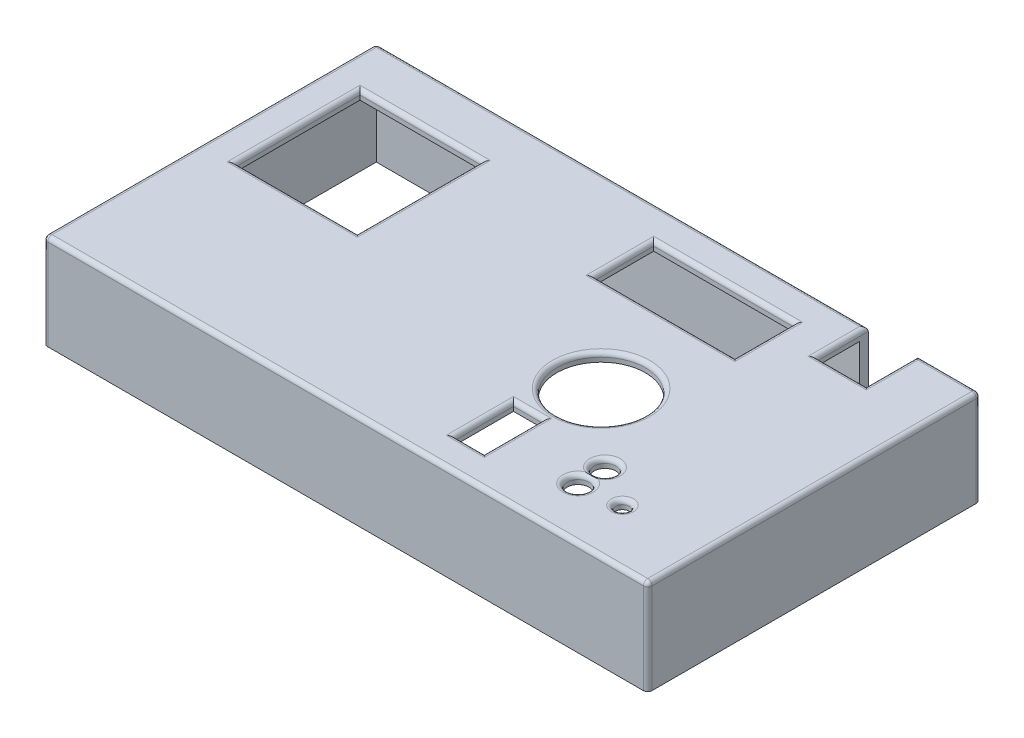
from build123d import *

# Parameters (mm, degrees)
BOSS_EXTRUDE3_DEPTH = 20
SKETCH5_W           = 6.84038608
SKETCH5_H           = 13.609372619
SKETCH5_R           = 2.512024295
SKETCH5_R_2         = 1.584207127
SKETCH5_R_3         = 10.279019558
SKETCH5_W_2         = 28.198374396
SKETCH5_H_2         = 28.800355601
SKETCH5_W_3         = 32.523037846
SKETCH5_H_3         = 13.726974854
BOSS_EXTRUDE4_DEPTH = 2
FILLET3_R           = 1


with BuildPart() as part:
    # Sketch2 → Boss-Extrude3 (new body)
    with BuildSketch(Plane(origin=(0, 0, 0), x_dir=(1, 0, 0), z_dir=(0, 1, 0))):
        Polygon((110.99009398, 73.936525273), (-2.957073914, 73.936525273), (-2.957073914, -3.151612903), (136.997180594, -3.151612903), (136.997180594, 73.936525273), (122.49022098, 73.936525273), (122.49022098, 71.936525273), (134.997180594, 71.936525273), (134.997180594, -1.151612903), (-0.957073914, -1.151612903), (-0.957073914, 71.936525273), (110.99009398, 71.936525273), align=None)
    extrude(amount=BOSS_EXTRUDE3_DEPTH)

    # Sketch5 → Boss-Extrude4 (add)
    # profile 1 of 2: a face of its own
    with BuildSketch(Plane(origin=(0, 20, 0), x_dir=(1, 0, 0), z_dir=(0, 1, 0))):
        Polygon((110.99009398, 61.978765558), (110.99009398, 71.936525273), (-0.957073914, 71.936525273), (-0.957073914, -1.151612903), (134.997180594, -1.151612903), (134.997180594, 71.936525273), (122.49022098, 71.936525273), (122.49022098, 61.978765558), align=None)
        with Locations((88.364033528, 11.013703328)):
            Rectangle(SKETCH5_W, SKETCH5_H, mode=Mode.SUBTRACT)
        with Locations(Location((108.873726401, 8.847726695, 0), (0, 0, 270))):
            Circle(SKETCH5_R, mode=Mode.SUBTRACT)
        with Locations(Location((118.390524318, 9.61196952, 0), (0, 0, 270))):
            Circle(SKETCH5_R_2, mode=Mode.SUBTRACT)
        with Locations(Location((108.746726147, 15.197739395, 0), (0, 0, 270))):
            Circle(SKETCH5_R, mode=Mode.SUBTRACT)
        with Locations(Location((92.483108966, 30.567056134, 0), (0, 0, 270))):
            Circle(SKETCH5_R_3, mode=Mode.SUBTRACT)
        with Locations((18.822961646, 48.078587758)):
            Rectangle(SKETCH5_W_2, SKETCH5_H_2, mode=Mode.SUBTRACT)
        with Locations((85.307569215, 59.332727965)):
            Rectangle(SKETCH5_W_3, SKETCH5_H_3, mode=Mode.SUBTRACT)
    # profile 2 of 2: a face of its own
    with BuildSketch(Plane(origin=(0, 20, 0), x_dir=(1, 0, 0), z_dir=(0, 1, 0))):
        Polygon((136.997180594, 73.936525273), (122.49022098, 73.936525273), (122.49022098, 71.936525273), (134.997180594, 71.936525273), (134.997180594, -1.151612903), (-0.957073914, -1.151612903), (-0.957073914, 71.936525273), (110.99009398, 71.936525273), (110.99009398, 73.936525273), (-2.957073914, 73.936525273), (-2.957073914, -3.151612903), (136.997180594, -3.151612903), align=None)
    extrude(amount=BOSS_EXTRUDE4_DEPTH)

    # Fillet3
    # the kernel refuses this fillet: 1 mm, written as the material it takes off along each edge
    with BuildSketch(Plane(origin=(135.997180594, 21, -72.936525273), x_dir=(1, 0, 0), z_dir=(0, 0, -1))) as fillet3_piece_1_section:
        Polygon((0, 0), (FILLET3_R, 0), (FILLET3_R, -FILLET3_R), (0, -FILLET3_R), align=None)
    fillet3_piece_1 = extrude(amount=FILLET3_R, mode=Mode.PRIVATE)
    fillet3_piece_1 = fillet3_piece_1 - Plane(origin=(135.997180594, 21, -72.936525273), x_dir=(-0.7071067811865475, -0.7071067811865475, 0), z_dir=(0, 0, -1)) * Sphere(FILLET3_R, mode=Mode.PRIVATE)
    add(fillet3_piece_1, mode=Mode.SUBTRACT)
    with BuildSketch(Plane(origin=(135.997180594, 21, 2.151612903), x_dir=(0, 0, 1), z_dir=(1, 0, 0))) as fillet3_piece_2_section:
        Polygon((0, 0), (FILLET3_R, 0), (FILLET3_R, -FILLET3_R), (0, -FILLET3_R), align=None)
    fillet3_piece_2 = extrude(amount=FILLET3_R, mode=Mode.PRIVATE)
    fillet3_piece_2 = fillet3_piece_2 - Plane(origin=(135.997180594, 21, 2.151612903), x_dir=(0, -0.7071067811865475, -0.7071067811865475), z_dir=(1, 0, 0)) * Sphere(FILLET3_R, mode=Mode.PRIVATE)
    add(fillet3_piece_2, mode=Mode.SUBTRACT)
    with BuildSketch(Plane(origin=(-1.957073914, 21, 2.151612903), x_dir=(-1, 0, 0), z_dir=(0, 0, 1))) as fillet3_piece_3_section:
        Polygon((0, 0), (FILLET3_R, 0), (FILLET3_R, -FILLET3_R), (0, -FILLET3_R), align=None)
    fillet3_piece_3 = extrude(amount=FILLET3_R, mode=Mode.PRIVATE)
    fillet3_piece_3 = fillet3_piece_3 - Plane(origin=(-1.957073914, 21, 2.151612903), x_dir=(0.7071067811865475, -0.7071067811865475, 0), z_dir=(0, 0, 1)) * Sphere(FILLET3_R, mode=Mode.PRIVATE)
    add(fillet3_piece_3, mode=Mode.SUBTRACT)
    with BuildSketch(Plane(origin=(-1.957073914, 21, -72.936525273), x_dir=(-1, 0, 0), z_dir=(0, 0, -1))) as fillet3_piece_4_section:
        Polygon((0, 0), (FILLET3_R, 0), (FILLET3_R, FILLET3_R), (0, FILLET3_R), align=None)
    fillet3_piece_4 = extrude(amount=FILLET3_R, mode=Mode.PRIVATE)
    fillet3_piece_4 = fillet3_piece_4 - Plane(origin=(-1.957073914, 21, -72.936525273), x_dir=(0.7071067811865475, -0.7071067811865475, 0), z_dir=(0, 0, -1)) * Sphere(FILLET3_R, mode=Mode.PRIVATE)
    add(fillet3_piece_4, mode=Mode.SUBTRACT)
    with BuildSketch(Plane(origin=(136.997180594, -2.5, -73.936525273), x_dir=(-1, 0, 0), z_dir=(0, 1, 0)), Plane(origin=(136.997180594, -2.5, 3.151612903), x_dir=(0, 0, -1), z_dir=(0, 1, 0)), Plane(origin=(-2.957073914, -2.5, 3.151612903), x_dir=(1, 0, 0), z_dir=(0, 1, 0))) as fillet3_piece_5:
        with BuildLine():
            CenterArc((FILLET3_R, FILLET3_R), FILLET3_R, 180, 90)
            Line((0, FILLET3_R), (0, 0))
            Line((0, 0), (FILLET3_R, 0))
        make_face()
    extrude(amount=23.5, mode=Mode.SUBTRACT)
    with BuildSketch(Plane(origin=(-2.957073914, -2.5, -73.936525273), x_dir=(1, 0, 0), z_dir=(0, 1, 0))) as fillet3_piece_6:
        with BuildLine():
            CenterArc((FILLET3_R, -FILLET3_R), FILLET3_R, 90, 90)
            Line((0, -FILLET3_R), (0, 0))
            Line((0, 0), (FILLET3_R, 0))
        make_face()
    extrude(amount=23.5, mode=Mode.SUBTRACT)
    with BuildSketch(Plane(origin=(69.046050292, 22, -52.469240538), x_dir=(0, -1, 0), z_dir=(0, 0, -1)), Plane(origin=(101.569088138, 22, -66.196215392), x_dir=(0, -1, 0), z_dir=(0, 0, 1))) as fillet3_piece_7:
        with BuildLine():
            CenterArc((FILLET3_R, FILLET3_R), FILLET3_R, 180, 90)
            Line((0, FILLET3_R), (0, 0))
            Line((0, 0), (FILLET3_R, 0))
        make_face()
    extrude(amount=13.726974854, mode=Mode.SUBTRACT)
    with BuildSketch(Plane(origin=(4.723774448, 22, -33.678409957), x_dir=(0, -1, 0), z_dir=(0, 0, -1)), Plane(origin=(32.922148844, 22, -62.478765558), x_dir=(0, -1, 0), z_dir=(0, 0, 1))) as fillet3_piece_8:
        with BuildLine():
            CenterArc((FILLET3_R, FILLET3_R), FILLET3_R, 180, 90)
            Line((0, FILLET3_R), (0, 0))
            Line((0, 0), (FILLET3_R, 0))
        make_face()
    extrude(amount=28.800355601, mode=Mode.SUBTRACT)
    with BuildSketch(Plane(origin=(84.943840488, 22, -4.209017018), x_dir=(0, -1, 0), z_dir=(0, 0, -1)), Plane(origin=(91.784226568, 22, -17.818389637), x_dir=(0, -1, 0), z_dir=(0, 0, 1))) as fillet3_piece_9:
        with BuildLine():
            CenterArc((FILLET3_R, FILLET3_R), FILLET3_R, 180, 90)
            Line((0, FILLET3_R), (0, 0))
            Line((0, 0), (FILLET3_R, 0))
        make_face()
    extrude(amount=13.609372619, mode=Mode.SUBTRACT)
    with BuildSketch(Plane(origin=(110.99009398, 22, -76.436525273), x_dir=(-1, 0, 0), z_dir=(0, 0, 1)), Plane(origin=(122.49022098, 22, -76.436525273), x_dir=(0, -1, 0), z_dir=(0, 0, 1))) as fillet3_piece_10:
        with BuildLine():
            CenterArc((FILLET3_R, FILLET3_R), FILLET3_R, 180, 90)
            Line((0, FILLET3_R), (0, 0))
            Line((0, 0), (FILLET3_R, 0))
        make_face()
    extrude(amount=14.457759716, mode=Mode.SUBTRACT)
    with BuildSketch(Plane(origin=(32.922148844, 22, -33.678409957), x_dir=(0, -1, 0), z_dir=(-1, 0, 0)), Plane(origin=(4.723774448, 22, -62.478765558), x_dir=(0, -1, 0), z_dir=(1, 0, 0))) as fillet3_piece_11:
        with BuildLine():
            CenterArc((FILLET3_R, FILLET3_R), FILLET3_R, 180, 90)
            Line((0, FILLET3_R), (0, 0))
            Line((0, 0), (FILLET3_R, 0))
        make_face()
    extrude(amount=28.198374397, mode=Mode.SUBTRACT)
    with BuildSketch(Plane(origin=(91.784226568, 22, -4.209017018), x_dir=(0, -1, 0), z_dir=(-1, 0, 0)), Plane(origin=(84.943840488, 22, -17.818389637), x_dir=(0, -1, 0), z_dir=(1, 0, 0))) as fillet3_piece_12:
        with BuildLine():
            CenterArc((FILLET3_R, FILLET3_R), FILLET3_R, 180, 90)
            Line((0, FILLET3_R), (0, 0))
            Line((0, 0), (FILLET3_R, 0))
        make_face()
    extrude(amount=6.840386081, mode=Mode.SUBTRACT)
    with BuildSketch(Plane(origin=(118.390524318, 22, -9.61196952), x_dir=(0, 0, 1), z_dir=(-1, 0, 0))) as fillet3_piece_13:
        with BuildLine():
            CenterArc((1.584207127 + FILLET3_R, -FILLET3_R), FILLET3_R, 90, 90)
            Line((1.584207127 + FILLET3_R, 0), (1.584207127, 0))
            Line((1.584207127, 0), (1.584207127, -FILLET3_R))
        make_face()
    revolve(axis=Axis((118.390524318, 22, -9.61196952), (0, 1, 0)), mode=Mode.SUBTRACT)
    with BuildSketch(Plane(origin=(92.483108966, 22, -30.567056134), x_dir=(0, 0, 1), z_dir=(-1, 0, 0))) as fillet3_piece_14:
        with BuildLine():
            CenterArc((10.279019558 + FILLET3_R, -FILLET3_R), FILLET3_R, 90, 90)
            Line((10.279019558 + FILLET3_R, 0), (10.279019558, 0))
            Line((10.279019558, 0), (10.279019558, -FILLET3_R))
        make_face()
    revolve(axis=Axis((92.483108966, 22, -30.567056134), (0, 1, 0)), mode=Mode.SUBTRACT)
    with BuildSketch(Plane(origin=(108.746726147, 22, -15.197739395), x_dir=(0, 0, 1), z_dir=(-1, 0, 0))) as fillet3_piece_15:
        with BuildLine():
            CenterArc((2.512024295 + FILLET3_R, -FILLET3_R), FILLET3_R, 90, 90)
            Line((2.512024295 + FILLET3_R, 0), (2.512024295, 0))
            Line((2.512024295, 0), (2.512024295, -FILLET3_R))
        make_face()
    revolve(axis=Axis((108.746726147, 22, -15.197739395), (0, 1, 0)), mode=Mode.SUBTRACT)
    with BuildSketch(Plane(origin=(108.873726401, 22, -8.847726695), x_dir=(0, 0, 1), z_dir=(-1, 0, 0))) as fillet3_piece_16:
        with BuildLine():
            CenterArc((2.512024295 + FILLET3_R, -FILLET3_R), FILLET3_R, 90, 90)
            Line((2.512024295 + FILLET3_R, 0), (2.512024295, 0))
            Line((2.512024295, 0), (2.512024295, -FILLET3_R))
        make_face()
    revolve(axis=Axis((108.873726401, 22, -8.847726695), (0, 1, 0)), mode=Mode.SUBTRACT)
    with BuildSketch(Plane(origin=(122.49022098, 22, -61.978765558), x_dir=(0, -1, 0), z_dir=(-1, 0, 0))) as fillet3_piece_17:
        with BuildLine():
            CenterArc((FILLET3_R, FILLET3_R), FILLET3_R, 180, 90)
            Line((0, FILLET3_R), (0, 0))
            Line((0, 0), (FILLET3_R, 0))
        make_face()
    extrude(amount=11.500127, mode=Mode.SUBTRACT)
    with BuildSketch(Plane(origin=(101.569088138, 22, -52.469240538), x_dir=(0, -1, 0), z_dir=(-1, 0, 0)), Plane(origin=(69.046050292, 22, -66.196215392), x_dir=(0, -1, 0), z_dir=(1, 0, 0))) as fillet3_piece_18:
        with BuildLine():
            CenterArc((FILLET3_R, FILLET3_R), FILLET3_R, 180, 90)
            Line((0, FILLET3_R), (0, 0))
            Line((0, 0), (FILLET3_R, 0))
        make_face()
    extrude(amount=32.523037846, mode=Mode.SUBTRACT)
    with BuildSketch(Plane(origin=(113.49009398, 22, -73.936525273), x_dir=(0, -1, 0), z_dir=(-1, 0, 0))) as fillet3_piece_19:
        with BuildLine():
            CenterArc((FILLET3_R, FILLET3_R), FILLET3_R, 180, 90)
            Line((0, FILLET3_R), (0, 0))
            Line((0, 0), (FILLET3_R, 0))
        make_face()
    extrude(amount=115.447167894, mode=Mode.SUBTRACT)
    with BuildSketch(Plane(origin=(-2.957073914, 22, -72.936525273), x_dir=(0, -1, 0), z_dir=(0, 0, 1)), Plane(origin=(136.997180594, 22, 2.151612903), x_dir=(0, -1, 0), z_dir=(0, 0, -1))) as fillet3_piece_20:
        with BuildLine():
            CenterArc((FILLET3_R, FILLET3_R), FILLET3_R, 180, 90)
            Line((0, FILLET3_R), (0, 0))
            Line((0, 0), (FILLET3_R, 0))
        make_face()
    extrude(amount=75.088138176, mode=Mode.SUBTRACT)
    with BuildSketch(Plane(origin=(-1.957073914, 22, 3.151612903), x_dir=(0, -1, 0), z_dir=(1, 0, 0))) as fillet3_piece_21:
        with BuildLine():
            CenterArc((FILLET3_R, FILLET3_R), FILLET3_R, 180, 90)
            Line((0, FILLET3_R), (0, 0))
            Line((0, 0), (FILLET3_R, 0))
        make_face()
    extrude(amount=137.954254509, mode=Mode.SUBTRACT)
    with BuildSketch(Plane(origin=(135.997180594, 22, -73.936525273), x_dir=(0, -1, 0), z_dir=(-1, 0, 0))) as fillet3_piece_22:
        with BuildLine():
            CenterArc((FILLET3_R, FILLET3_R), FILLET3_R, 180, 90)
            Line((0, FILLET3_R), (0, 0))
            Line((0, 0), (FILLET3_R, 0))
        make_face()
    extrude(amount=16.006959614, mode=Mode.SUBTRACT)
    with BuildSketch(Plane(origin=(101.569088138, 22, -52.469240538), x_dir=(0, -1, 0), z_dir=(-1, 0, 0))) as fillet3_piece_23a_section:
        with BuildLine():
            CenterArc((FILLET3_R, FILLET3_R), FILLET3_R, 180, 90)
            Line((0, FILLET3_R), (0, 0))
            Line((0, 0), (FILLET3_R, 0))
        make_face()
    fillet3_piece_23a = extrude(amount=35.023037846, mode=Mode.PRIVATE)
    fillet3_piece_23a = split(fillet3_piece_23a, bisect_by=Plane(origin=(69.046050292, 21.773604886, -52.242845424), z_dir=(-1, 0, 0)), keep=Keep.TOP, mode=Mode.PRIVATE)
    with BuildSketch(Plane(origin=(69.046050292, 22, -49.969240538), x_dir=(0, -1, 0), z_dir=(0, 0, -1))) as fillet3_piece_23b_section:
        with BuildLine():
            CenterArc((FILLET3_R, FILLET3_R), FILLET3_R, 180, 90)
            Line((0, FILLET3_R), (0, 0))
            Line((0, 0), (FILLET3_R, 0))
        make_face()
    fillet3_piece_23b = extrude(amount=16.226974854, mode=Mode.PRIVATE)
    fillet3_piece_23b = split(fillet3_piece_23b, bisect_by=Plane(origin=(68.819655178, 21.773604886, -52.469240538), z_dir=(0, 0, 1)), keep=Keep.TOP, mode=Mode.PRIVATE)
    fillet3_piece_23 = fillet3_piece_23a & fillet3_piece_23b
    add(fillet3_piece_23, mode=Mode.SUBTRACT)
    with BuildSketch(Plane(origin=(66.546050292, 22, -66.196215392), x_dir=(0, -1, 0), z_dir=(1, 0, 0))) as fillet3_piece_24a_section:
        with BuildLine():
            CenterArc((FILLET3_R, FILLET3_R), FILLET3_R, 180, 90)
            Line((0, FILLET3_R), (0, 0))
            Line((0, 0), (FILLET3_R, 0))
        make_face()
    fillet3_piece_24a = extrude(amount=35.023037846, mode=Mode.PRIVATE)
    fillet3_piece_24a = split(fillet3_piece_24a, bisect_by=Plane(origin=(69.046050292, 21.773604886, -66.422610507), z_dir=(-1, 0, 0)), keep=Keep.TOP, mode=Mode.PRIVATE)
    with BuildSketch(Plane(origin=(69.046050292, 22, -52.469240538), x_dir=(0, -1, 0), z_dir=(0, 0, -1))) as fillet3_piece_24b_section:
        with BuildLine():
            CenterArc((FILLET3_R, FILLET3_R), FILLET3_R, 180, 90)
            Line((0, FILLET3_R), (0, 0))
            Line((0, 0), (FILLET3_R, 0))
        make_face()
    fillet3_piece_24b = extrude(amount=16.226974854, mode=Mode.PRIVATE)
    fillet3_piece_24b = split(fillet3_piece_24b, bisect_by=Plane(origin=(68.819655178, 21.773604886, -66.196215392), z_dir=(0, 0, -1)), keep=Keep.TOP, mode=Mode.PRIVATE)
    fillet3_piece_24 = fillet3_piece_24a & fillet3_piece_24b
    add(fillet3_piece_24, mode=Mode.SUBTRACT)
    with BuildSketch(Plane(origin=(32.922148844, 22, -33.678409957), x_dir=(0, -1, 0), z_dir=(-1, 0, 0))) as fillet3_piece_25a_section:
        with BuildLine():
            CenterArc((FILLET3_R, FILLET3_R), FILLET3_R, 180, 90)
            Line((0, FILLET3_R), (0, 0))
            Line((0, 0), (FILLET3_R, 0))
        make_face()
    fillet3_piece_25a = extrude(amount=30.698374397, mode=Mode.PRIVATE)
    fillet3_piece_25a = split(fillet3_piece_25a, bisect_by=Plane(origin=(4.723774448, 21.773604886, -33.452014843), z_dir=(-1, 0, 0)), keep=Keep.TOP, mode=Mode.PRIVATE)
    with BuildSketch(Plane(origin=(4.723774448, 22, -31.178409957), x_dir=(0, -1, 0), z_dir=(0, 0, -1))) as fillet3_piece_25b_section:
        with BuildLine():
            CenterArc((FILLET3_R, FILLET3_R), FILLET3_R, 180, 90)
            Line((0, FILLET3_R), (0, 0))
            Line((0, 0), (FILLET3_R, 0))
        make_face()
    fillet3_piece_25b = extrude(amount=31.300355601, mode=Mode.PRIVATE)
    fillet3_piece_25b = split(fillet3_piece_25b, bisect_by=Plane(origin=(4.497379333, 21.773604886, -33.678409957), z_dir=(0, 0, 1)), keep=Keep.TOP, mode=Mode.PRIVATE)
    fillet3_piece_25 = fillet3_piece_25a & fillet3_piece_25b
    add(fillet3_piece_25, mode=Mode.SUBTRACT)
    with BuildSketch(Plane(origin=(2.223774448, 22, -62.478765558), x_dir=(0, -1, 0), z_dir=(1, 0, 0))) as fillet3_piece_26a_section:
        with BuildLine():
            CenterArc((FILLET3_R, FILLET3_R), FILLET3_R, 180, 90)
            Line((0, FILLET3_R), (0, 0))
            Line((0, 0), (FILLET3_R, 0))
        make_face()
    fillet3_piece_26a = extrude(amount=30.698374397, mode=Mode.PRIVATE)
    fillet3_piece_26a = split(fillet3_piece_26a, bisect_by=Plane(origin=(4.723774448, 21.773604886, -62.705160672), z_dir=(-1, 0, 0)), keep=Keep.TOP, mode=Mode.PRIVATE)
    with BuildSketch(Plane(origin=(4.723774448, 22, -33.678409957), x_dir=(0, -1, 0), z_dir=(0, 0, -1))) as fillet3_piece_26b_section:
        with BuildLine():
            CenterArc((FILLET3_R, FILLET3_R), FILLET3_R, 180, 90)
            Line((0, FILLET3_R), (0, 0))
            Line((0, 0), (FILLET3_R, 0))
        make_face()
    fillet3_piece_26b = extrude(amount=31.300355601, mode=Mode.PRIVATE)
    fillet3_piece_26b = split(fillet3_piece_26b, bisect_by=Plane(origin=(4.497379333, 21.773604886, -62.478765558), z_dir=(0, 0, -1)), keep=Keep.TOP, mode=Mode.PRIVATE)
    fillet3_piece_26 = fillet3_piece_26a & fillet3_piece_26b
    add(fillet3_piece_26, mode=Mode.SUBTRACT)
    with BuildSketch(Plane(origin=(91.784226568, 22, -4.209017018), x_dir=(0, -1, 0), z_dir=(-1, 0, 0))) as fillet3_piece_27a_section:
        with BuildLine():
            CenterArc((FILLET3_R, FILLET3_R), FILLET3_R, 180, 90)
            Line((0, FILLET3_R), (0, 0))
            Line((0, 0), (FILLET3_R, 0))
        make_face()
    fillet3_piece_27a = extrude(amount=9.340386081, mode=Mode.PRIVATE)
    fillet3_piece_27a = split(fillet3_piece_27a, bisect_by=Plane(origin=(84.943840488, 21.773604886, -3.982621904), z_dir=(-1, 0, 0)), keep=Keep.TOP, mode=Mode.PRIVATE)
    with BuildSketch(Plane(origin=(84.943840488, 22, -1.709017018), x_dir=(0, -1, 0), z_dir=(0, 0, -1))) as fillet3_piece_27b_section:
        with BuildLine():
            CenterArc((FILLET3_R, FILLET3_R), FILLET3_R, 180, 90)
            Line((0, FILLET3_R), (0, 0))
            Line((0, 0), (FILLET3_R, 0))
        make_face()
    fillet3_piece_27b = extrude(amount=16.109372619, mode=Mode.PRIVATE)
    fillet3_piece_27b = split(fillet3_piece_27b, bisect_by=Plane(origin=(84.717445373, 21.773604886, -4.209017018), z_dir=(0, 0, 1)), keep=Keep.TOP, mode=Mode.PRIVATE)
    fillet3_piece_27 = fillet3_piece_27a & fillet3_piece_27b
    add(fillet3_piece_27, mode=Mode.SUBTRACT)
    with BuildSketch(Plane(origin=(82.443840488, 22, -17.818389637), x_dir=(0, -1, 0), z_dir=(1, 0, 0))) as fillet3_piece_28a_section:
        with BuildLine():
            CenterArc((FILLET3_R, FILLET3_R), FILLET3_R, 180, 90)
            Line((0, FILLET3_R), (0, 0))
            Line((0, 0), (FILLET3_R, 0))
        make_face()
    fillet3_piece_28a = extrude(amount=9.340386081, mode=Mode.PRIVATE)
    fillet3_piece_28a = split(fillet3_piece_28a, bisect_by=Plane(origin=(84.943840488, 21.773604886, -18.044784751), z_dir=(-1, 0, 0)), keep=Keep.TOP, mode=Mode.PRIVATE)
    with BuildSketch(Plane(origin=(84.943840488, 22, -4.209017018), x_dir=(0, -1, 0), z_dir=(0, 0, -1))) as fillet3_piece_28b_section:
        with BuildLine():
            CenterArc((FILLET3_R, FILLET3_R), FILLET3_R, 180, 90)
            Line((0, FILLET3_R), (0, 0))
            Line((0, 0), (FILLET3_R, 0))
        make_face()
    fillet3_piece_28b = extrude(amount=16.109372619, mode=Mode.PRIVATE)
    fillet3_piece_28b = split(fillet3_piece_28b, bisect_by=Plane(origin=(84.717445373, 21.773604886, -17.818389637), z_dir=(0, 0, -1)), keep=Keep.TOP, mode=Mode.PRIVATE)
    fillet3_piece_28 = fillet3_piece_28a & fillet3_piece_28b
    add(fillet3_piece_28, mode=Mode.SUBTRACT)
    with BuildSketch(Plane(origin=(122.49022098, 22, -61.978765558), x_dir=(0, -1, 0), z_dir=(-1, 0, 0))) as fillet3_piece_29a_section:
        with BuildLine():
            CenterArc((FILLET3_R, FILLET3_R), FILLET3_R, 180, 90)
            Line((0, FILLET3_R), (0, 0))
            Line((0, 0), (FILLET3_R, 0))
        make_face()
    fillet3_piece_29a = extrude(amount=14.000127, mode=Mode.PRIVATE)
    fillet3_piece_29a = split(fillet3_piece_29a, bisect_by=Plane(origin=(110.99009398, 21.773604886, -61.752370443), z_dir=(-1, 0, 0)), keep=Keep.TOP, mode=Mode.PRIVATE)
    with BuildSketch(Plane(origin=(110.99009398, 22, -76.436525273), x_dir=(-1, 0, 0), z_dir=(0, 0, 1))) as fillet3_piece_29b_section:
        with BuildLine():
            CenterArc((FILLET3_R, FILLET3_R), FILLET3_R, 180, 90)
            Line((0, FILLET3_R), (0, 0))
            Line((0, 0), (FILLET3_R, 0))
        make_face()
    fillet3_piece_29b = extrude(amount=16.957759716, mode=Mode.PRIVATE)
    fillet3_piece_29b = split(fillet3_piece_29b, bisect_by=Plane(origin=(110.763698866, 21.773604886, -61.978765558), z_dir=(0, 0, 1)), keep=Keep.TOP, mode=Mode.PRIVATE)
    fillet3_piece_29 = fillet3_piece_29a & fillet3_piece_29b
    add(fillet3_piece_29, mode=Mode.SUBTRACT)
    with BuildSketch(Plane(origin=(32.922148844, 22, -62.478765558), x_dir=(0, -1, 0), z_dir=(0, 0, 1))) as fillet3_piece_30a_section:
        with BuildLine():
            CenterArc((FILLET3_R, FILLET3_R), FILLET3_R, 180, 90)
            Line((0, FILLET3_R), (0, 0))
            Line((0, 0), (FILLET3_R, 0))
        make_face()
    fillet3_piece_30a = extrude(amount=31.300355601, mode=Mode.PRIVATE)
    fillet3_piece_30a = split(fillet3_piece_30a, bisect_by=Plane(origin=(33.148543959, 21.773604886, -33.678409957), z_dir=(0, 0, 1)), keep=Keep.TOP, mode=Mode.PRIVATE)
    with BuildSketch(Plane(origin=(35.422148844, 22, -33.678409957), x_dir=(0, -1, 0), z_dir=(-1, 0, 0))) as fillet3_piece_30b_section:
        with BuildLine():
            CenterArc((FILLET3_R, FILLET3_R), FILLET3_R, 180, 90)
            Line((0, FILLET3_R), (0, 0))
            Line((0, 0), (FILLET3_R, 0))
        make_face()
    fillet3_piece_30b = extrude(amount=30.698374397, mode=Mode.PRIVATE)
    fillet3_piece_30b = split(fillet3_piece_30b, bisect_by=Plane(origin=(32.922148844, 21.773604886, -33.452014843), z_dir=(1, 0, 0)), keep=Keep.TOP, mode=Mode.PRIVATE)
    fillet3_piece_30 = fillet3_piece_30a & fillet3_piece_30b
    add(fillet3_piece_30, mode=Mode.SUBTRACT)
    with BuildSketch(Plane(origin=(91.784226568, 22, -17.818389637), x_dir=(0, -1, 0), z_dir=(0, 0, 1))) as fillet3_piece_31a_section:
        with BuildLine():
            CenterArc((FILLET3_R, FILLET3_R), FILLET3_R, 180, 90)
            Line((0, FILLET3_R), (0, 0))
            Line((0, 0), (FILLET3_R, 0))
        make_face()
    fillet3_piece_31a = extrude(amount=16.109372619, mode=Mode.PRIVATE)
    fillet3_piece_31a = split(fillet3_piece_31a, bisect_by=Plane(origin=(92.010621683, 21.773604886, -4.209017018), z_dir=(0, 0, 1)), keep=Keep.TOP, mode=Mode.PRIVATE)
    with BuildSketch(Plane(origin=(94.284226568, 22, -4.209017018), x_dir=(0, -1, 0), z_dir=(-1, 0, 0))) as fillet3_piece_31b_section:
        with BuildLine():
            CenterArc((FILLET3_R, FILLET3_R), FILLET3_R, 180, 90)
            Line((0, FILLET3_R), (0, 0))
            Line((0, 0), (FILLET3_R, 0))
        make_face()
    fillet3_piece_31b = extrude(amount=9.340386081, mode=Mode.PRIVATE)
    fillet3_piece_31b = split(fillet3_piece_31b, bisect_by=Plane(origin=(91.784226568, 21.773604886, -3.982621904), z_dir=(1, 0, 0)), keep=Keep.TOP, mode=Mode.PRIVATE)
    fillet3_piece_31 = fillet3_piece_31a & fillet3_piece_31b
    add(fillet3_piece_31, mode=Mode.SUBTRACT)
    with BuildSketch(Plane(origin=(124.99022098, 22, -61.978765558), x_dir=(0, -1, 0), z_dir=(-1, 0, 0))) as fillet3_piece_32a_section:
        with BuildLine():
            CenterArc((FILLET3_R, FILLET3_R), FILLET3_R, 180, 90)
            Line((0, FILLET3_R), (0, 0))
            Line((0, 0), (FILLET3_R, 0))
        make_face()
    fillet3_piece_32a = extrude(amount=14.000127, mode=Mode.PRIVATE)
    fillet3_piece_32a = split(fillet3_piece_32a, bisect_by=Plane(origin=(122.49022098, 21.773604886, -61.752370443), z_dir=(1, 0, 0)), keep=Keep.TOP, mode=Mode.PRIVATE)
    with BuildSketch(Plane(origin=(122.49022098, 22, -76.436525273), x_dir=(0, -1, 0), z_dir=(0, 0, 1))) as fillet3_piece_32b_section:
        with BuildLine():
            CenterArc((FILLET3_R, FILLET3_R), FILLET3_R, 180, 90)
            Line((0, FILLET3_R), (0, 0))
            Line((0, 0), (FILLET3_R, 0))
        make_face()
    fillet3_piece_32b = extrude(amount=16.957759716, mode=Mode.PRIVATE)
    fillet3_piece_32b = split(fillet3_piece_32b, bisect_by=Plane(origin=(122.716616095, 21.773604886, -61.978765558), z_dir=(0, 0, 1)), keep=Keep.TOP, mode=Mode.PRIVATE)
    fillet3_piece_32 = fillet3_piece_32a & fillet3_piece_32b
    add(fillet3_piece_32, mode=Mode.SUBTRACT)
    with BuildSketch(Plane(origin=(101.569088138, 22, -66.196215392), x_dir=(0, -1, 0), z_dir=(0, 0, 1))) as fillet3_piece_33a_section:
        with BuildLine():
            CenterArc((FILLET3_R, FILLET3_R), FILLET3_R, 180, 90)
            Line((0, FILLET3_R), (0, 0))
            Line((0, 0), (FILLET3_R, 0))
        make_face()
    fillet3_piece_33a = extrude(amount=16.226974854, mode=Mode.PRIVATE)
    fillet3_piece_33a = split(fillet3_piece_33a, bisect_by=Plane(origin=(101.795483252, 21.773604886, -52.469240538), z_dir=(0, 0, 1)), keep=Keep.TOP, mode=Mode.PRIVATE)
    with BuildSketch(Plane(origin=(104.069088138, 22, -52.469240538), x_dir=(0, -1, 0), z_dir=(-1, 0, 0))) as fillet3_piece_33b_section:
        with BuildLine():
            CenterArc((FILLET3_R, FILLET3_R), FILLET3_R, 180, 90)
            Line((0, FILLET3_R), (0, 0))
            Line((0, 0), (FILLET3_R, 0))
        make_face()
    fillet3_piece_33b = extrude(amount=35.023037846, mode=Mode.PRIVATE)
    fillet3_piece_33b = split(fillet3_piece_33b, bisect_by=Plane(origin=(101.569088138, 21.773604886, -52.242845424), z_dir=(1, 0, 0)), keep=Keep.TOP, mode=Mode.PRIVATE)
    fillet3_piece_33 = fillet3_piece_33a & fillet3_piece_33b
    add(fillet3_piece_33, mode=Mode.SUBTRACT)
    with BuildSketch(Plane(origin=(91.784226568, 22, -20.318389637), x_dir=(0, -1, 0), z_dir=(0, 0, 1))) as fillet3_piece_34a_section:
        with BuildLine():
            CenterArc((FILLET3_R, FILLET3_R), FILLET3_R, 180, 90)
            Line((0, FILLET3_R), (0, 0))
            Line((0, 0), (FILLET3_R, 0))
        make_face()
    fillet3_piece_34a = extrude(amount=16.109372619, mode=Mode.PRIVATE)
    fillet3_piece_34a = split(fillet3_piece_34a, bisect_by=Plane(origin=(92.010621683, 21.773604886, -17.818389637), z_dir=(0, 0, -1)), keep=Keep.TOP, mode=Mode.PRIVATE)
    with BuildSketch(Plane(origin=(84.943840488, 22, -17.818389637), x_dir=(0, -1, 0), z_dir=(1, 0, 0))) as fillet3_piece_34b_section:
        with BuildLine():
            CenterArc((FILLET3_R, FILLET3_R), FILLET3_R, 180, 90)
            Line((0, FILLET3_R), (0, 0))
            Line((0, 0), (FILLET3_R, 0))
        make_face()
    fillet3_piece_34b = extrude(amount=9.340386081, mode=Mode.PRIVATE)
    fillet3_piece_34b = split(fillet3_piece_34b, bisect_by=Plane(origin=(91.784226568, 21.773604886, -18.044784751), z_dir=(1, 0, 0)), keep=Keep.TOP, mode=Mode.PRIVATE)
    fillet3_piece_34 = fillet3_piece_34a & fillet3_piece_34b
    add(fillet3_piece_34, mode=Mode.SUBTRACT)
    with BuildSketch(Plane(origin=(32.922148844, 22, -64.978765558), x_dir=(0, -1, 0), z_dir=(0, 0, 1))) as fillet3_piece_35a_section:
        with BuildLine():
            CenterArc((FILLET3_R, FILLET3_R), FILLET3_R, 180, 90)
            Line((0, FILLET3_R), (0, 0))
            Line((0, 0), (FILLET3_R, 0))
        make_face()
    fillet3_piece_35a = extrude(amount=31.300355601, mode=Mode.PRIVATE)
    fillet3_piece_35a = split(fillet3_piece_35a, bisect_by=Plane(origin=(33.148543959, 21.773604886, -62.478765558), z_dir=(0, 0, -1)), keep=Keep.TOP, mode=Mode.PRIVATE)
    with BuildSketch(Plane(origin=(4.723774448, 22, -62.478765558), x_dir=(0, -1, 0), z_dir=(1, 0, 0))) as fillet3_piece_35b_section:
        with BuildLine():
            CenterArc((FILLET3_R, FILLET3_R), FILLET3_R, 180, 90)
            Line((0, FILLET3_R), (0, 0))
            Line((0, 0), (FILLET3_R, 0))
        make_face()
    fillet3_piece_35b = extrude(amount=30.698374397, mode=Mode.PRIVATE)
    fillet3_piece_35b = split(fillet3_piece_35b, bisect_by=Plane(origin=(32.922148844, 21.773604886, -62.705160672), z_dir=(1, 0, 0)), keep=Keep.TOP, mode=Mode.PRIVATE)
    fillet3_piece_35 = fillet3_piece_35a & fillet3_piece_35b
    add(fillet3_piece_35, mode=Mode.SUBTRACT)
    with BuildSketch(Plane(origin=(101.569088138, 22, -68.696215392), x_dir=(0, -1, 0), z_dir=(0, 0, 1))) as fillet3_piece_36a_section:
        with BuildLine():
            CenterArc((FILLET3_R, FILLET3_R), FILLET3_R, 180, 90)
            Line((0, FILLET3_R), (0, 0))
            Line((0, 0), (FILLET3_R, 0))
        make_face()
    fillet3_piece_36a = extrude(amount=16.226974854, mode=Mode.PRIVATE)
    fillet3_piece_36a = split(fillet3_piece_36a, bisect_by=Plane(origin=(101.795483252, 21.773604886, -66.196215392), z_dir=(0, 0, -1)), keep=Keep.TOP, mode=Mode.PRIVATE)
    with BuildSketch(Plane(origin=(69.046050292, 22, -66.196215392), x_dir=(0, -1, 0), z_dir=(1, 0, 0))) as fillet3_piece_36b_section:
        with BuildLine():
            CenterArc((FILLET3_R, FILLET3_R), FILLET3_R, 180, 90)
            Line((0, FILLET3_R), (0, 0))
            Line((0, 0), (FILLET3_R, 0))
        make_face()
    fillet3_piece_36b = extrude(amount=35.023037846, mode=Mode.PRIVATE)
    fillet3_piece_36b = split(fillet3_piece_36b, bisect_by=Plane(origin=(101.569088138, 21.773604886, -66.422610507), z_dir=(1, 0, 0)), keep=Keep.TOP, mode=Mode.PRIVATE)
    fillet3_piece_36 = fillet3_piece_36a & fillet3_piece_36b
    add(fillet3_piece_36, mode=Mode.SUBTRACT)


solid = part.part
